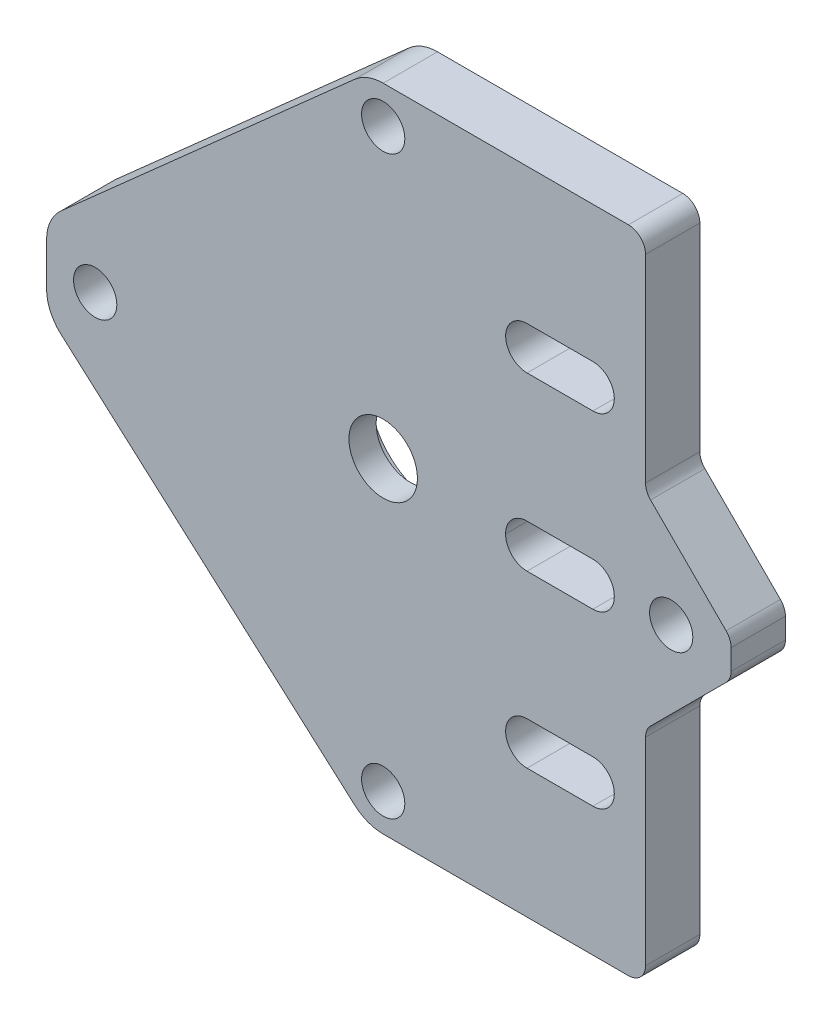
from build123d import *

# Parameters (mm, degrees)
SKETCH1_R                 = 4
SKETCH1_R_2               = 2.527736539
BOSS_EXTRUDE1_DEPTH       = 6.35
F_5_0MM_DOWEL_SLOT1_DEPTH = 6.35
SKETCH4_R                 = 8
CUT_EXTRUDE1_DEPTH        = 3.175


# Read off the part's stored shape, not the designer's step: Ø5.0mm Dowel Slot1
with BuildPart() as part:
    # Sketch1 → Boss-Extrude1 (new body)
    with BuildSketch(Plane.XY):
        with BuildLine():
            Line((8, -57.58012907), (-20.66, -57.58012907))
            ThreePointArc((-20.66, -57.58012907), (-22.435973202, -57.254090899), (-23.980332383, -56.318496743))
            Line((-23.980332383, -56.318496743), (-58.320332383, -25.818496743))
            ThreePointArc((-58.320332383, -25.818496743), (-59.560792799, -24.12931648), (-60, -22.08012907))
            Line((-60, -22.08012907), (-60, -17.08012907))
            ThreePointArc((-60, -17.08012907), (-59.560792799, -15.03094166), (-58.320332383, -13.341761396))
            Line((-58.320332383, -13.341761396), (-23.980332383, 17.158238604))
            ThreePointArc((-23.980332383, 17.158238604), (-22.435973202, 18.09383276), (-20.66, 18.41987093))
            Line((-20.66, 18.41987093), (8, 18.41987093))
            ThreePointArc((8, 18.41987093), (9.414213562, 17.834084493), (10, 16.41987093))
            Line((10, 16.41987093), (10, -6.725270109))
            ThreePointArc((10, -6.725270109), (10.152279768, -7.490730718), (10.585929943, -8.139627163))
            Line((10.585929943, -8.139627163), (19.414070057, -16.965975896))
            ThreePointArc((19.414070057, -16.965975896), (19.847720232, -17.614872341), (20, -18.38033295))
            Line((20, -18.38033295), (20, -20.77992519))
            ThreePointArc((20, -20.77992519), (19.847720232, -21.545385798), (19.414070057, -22.194282243))
            Line((19.414070057, -22.194282243), (10.585929943, -31.020630977))
            ThreePointArc((10.585929943, -31.020630977), (10.152279768, -31.669527422), (10, -32.43498803))
            Line((10, -32.43498803), (10, -55.58012907))
            ThreePointArc((10, -55.58012907), (9.414213562, -56.994342632), (8, -57.58012907))
        make_face()
        with Locations((-20.66, -19.58012907)):
            Circle(SKETCH1_R, mode=Mode.SUBTRACT)
        with Locations((-54.318282784, -19.58012907)):
            Circle(SKETCH1_R_2, mode=Mode.SUBTRACT)
        with Locations((-20.66, 14.050414337)):
            Circle(SKETCH1_R_2, mode=Mode.SUBTRACT)
        with Locations((12.998282784, -19.58012907)):
            Circle(SKETCH1_R_2, mode=Mode.SUBTRACT)
        with Locations((-20.66, -53.238409212)):
            Circle(SKETCH1_R_2, mode=Mode.SUBTRACT)
    extrude(amount=BOSS_EXTRUDE1_DEPTH)

    # Ø5.0mm Dowel Slot1 outline → Ø5.0mm Dowel Slot1 (cut)
    with BuildSketch(Plane.XY):
        with BuildLine():
            ThreePointArc((3.85, -22.567426083), (5.629646398, -21.823233219), (6.349772676, -20.033713042))
            ThreePointArc((6.349772676, -20.033713042), (5.629646398, -18.244192864), (3.85, -17.5))
            Line((3.85, -17.5), (-3.85, -17.5))
            ThreePointArc((-3.85, -17.5), (-5.629646398, -18.244192864), (-6.349772676, -20.033713042))
            ThreePointArc((-6.349772676, -20.033713042), (-5.629646398, -21.823233219), (-3.85, -22.567426083))
            Line((-3.85, -22.567426083), (3.85, -22.567426083))
        make_face()
        with BuildLine():
            Line((-3.85, -2.5), (3.85, -2.5))
            ThreePointArc((3.85, -2.5), (6.35, 0), (3.85, 2.5))
            Line((3.85, 2.5), (-3.85, 2.5))
            ThreePointArc((-3.85, 2.5), (-6.35, 0), (-3.85, -2.5))
        make_face()
        with BuildLine():
            Line((-3.85, -42.5), (3.85, -42.5))
            ThreePointArc((3.85, -42.5), (6.35, -40), (3.85, -37.5))
            Line((3.85, -37.5), (-3.85, -37.5))
            ThreePointArc((-3.85, -37.5), (-6.35, -40), (-3.85, -42.5))
        make_face()
    extrude(amount=F_5_0MM_DOWEL_SLOT1_DEPTH, mode=Mode.SUBTRACT)

    # Sketch4 → Cut-Extrude1 (cut)
    with BuildSketch(Plane(origin=(0, 0, 0), x_dir=(-1, 0, 0), z_dir=(0, 0, -1))):
        with Locations((20.66, -19.58012907)):
            Circle(SKETCH4_R)
    extrude(amount=-CUT_EXTRUDE1_DEPTH, mode=Mode.SUBTRACT)


solid = part.part
